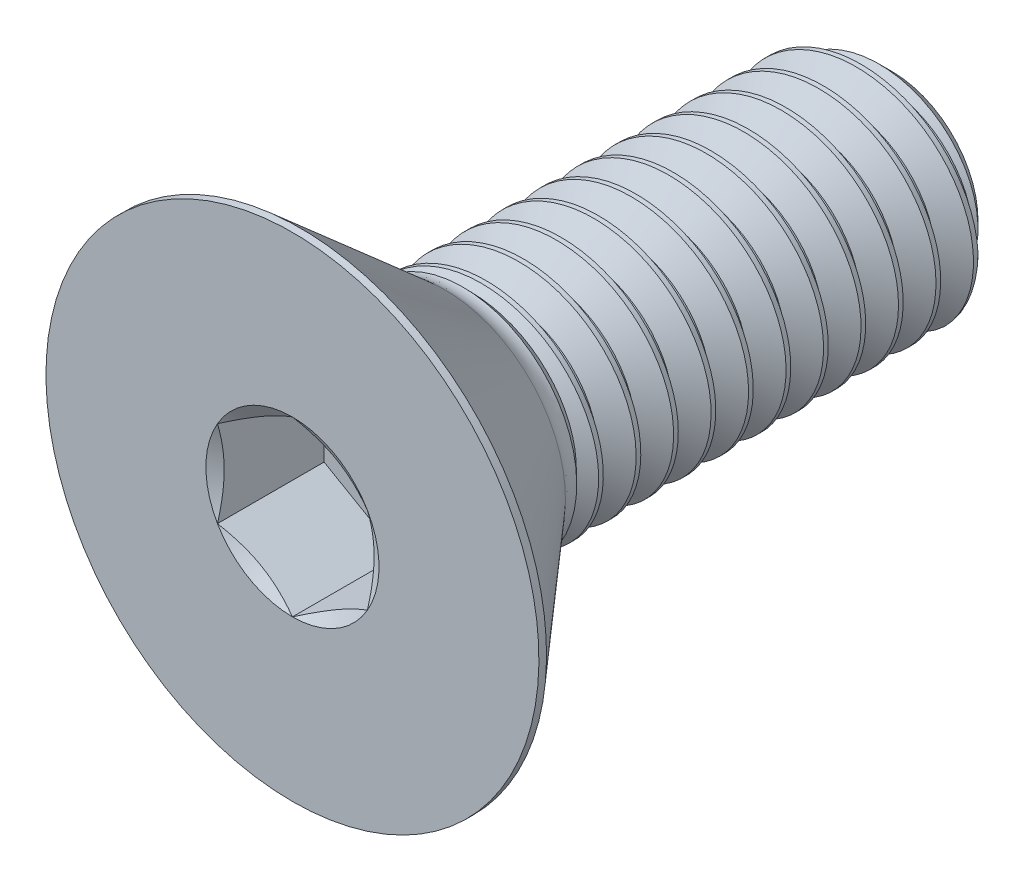
from build123d import *

# Parameters (mm, degrees)
SKETCH1_W          = 12.7
SKETCH1_H          = 2.413
CHAMFER1_SIZE      = 0.5953125
CUT_SWEEP1_PITCH   = 0.79375
CUT_EXTRUDE2_DEPTH = 2.25806


with BuildPart() as part:
    # Sketch1 → Revolve1 (revolve)
    with BuildSketch(Plane(origin=(0, 0, 0), x_dir=(0, 0, -1), z_dir=(1, 0, 0))):
        with Locations((6.35, 1.2065)):
            Rectangle(SKETCH1_W, SKETCH1_H)
    revolve(axis=Axis((0, 0, -12.7), (0, 0, 1)))

    # Chamfer1
    chamfer1_edges = [part.edges().sort_by_distance(p)[0] for p in [
        (0, -2.413, -12.7),
    ]]
    chamfer(chamfer1_edges, length=CHAMFER1_SIZE)

    # Cut-Sweep1: the profile of Sketch2 profile screwed along a right-hand helix of 16 turns, 8 arcs to a turn; built about Z, then put on its axis
    cut_sweep1_z = Axis((0, 0, 0), (0, 0, 1))
    cut_sweep1_corners = [(2.4136, 0, 0.00034641), (2.4136, 0, -0.69487766), (1.897444252, 0, -0.396875), (1.897444252, 0, -0.29765625)]
    with BuildLine(mode=Mode.PRIVATE) as cut_sweep1_profile:
        Line(cut_sweep1_corners[0], cut_sweep1_corners[1])
        Line(cut_sweep1_corners[1], cut_sweep1_corners[2])
        Line(cut_sweep1_corners[2], cut_sweep1_corners[3])
        Line(cut_sweep1_corners[3], cut_sweep1_corners[0])
    cut_sweep1_cap = Face(cut_sweep1_profile.wire())
    cut_sweep1_turn_angles = [0, 22.5, 45, 67.5, 90, 112.5, 135, 157.5, 180, 202.5, 225, 247.5, 270, 292.5, 315, 337.5, 360]
    cut_sweep1_turn_weights = [1, 0.9238795325112867, 1, 0.9238795325112867, 1, 0.9238795325112867, 1, 0.9238795325112867, 1, 0.9238795325112867, 1, 0.9238795325112867, 1, 0.9238795325112867, 1, 0.9238795325112867, 1]
    cut_sweep1_turn_rails = [Edge.make_bspline([Vector(p[0], p[1], 0).rotate(cut_sweep1_z, cut_sweep1_turn_angles[k]) / cut_sweep1_turn_weights[k] + Vector(0, 0, p[2] + CUT_SWEEP1_PITCH * cut_sweep1_turn_angles[k] / 360) for k in range(17)], [0, 0, 0, 1, 1, 2, 2, 3, 3, 4, 4, 5, 5, 6, 6, 7, 7, 8, 8, 8], 2, cut_sweep1_turn_weights) for p in cut_sweep1_corners]
    cut_sweep1_turn_sides = [Face.make_surface_from_curves(cut_sweep1_turn_rails[p[0]], cut_sweep1_turn_rails[p[1]]) for p in [(0, 1), (1, 2), (2, 3), (3, 0)]]
    cut_sweep1 = Plane(origin=(0, 0, -12.7), x_dir=(0, 1, 0), z_dir=(0, 0, 1)) * Solid(Shell([*[p.moved(Location((0, 0, CUT_SWEEP1_PITCH * i))) for i in range(16) for p in cut_sweep1_turn_sides], cut_sweep1_cap, cut_sweep1_cap.rotate(cut_sweep1_z, 5760).moved(Location((0, 0, CUT_SWEEP1_PITCH * 5760 / 360)))]))
    add(cut_sweep1, mode=Mode.SUBTRACT)

    # Sketch7 → Revolve2 (revolve)
    with BuildSketch(Plane(origin=(0, 0, 0), x_dir=(0, 0, -1), z_dir=(1, 0, 0)), mode=Mode.PRIVATE) as revolve2_sk:
        with BuildLine():
            Line((0, 5.2197), (0.16129, 5.2197))
            Line((0.16129, 5.2197), (3.2258, 2.555762099))
            ThreePointArc((3.2258, 2.555762099), (3.403809493, 2.44985758), (3.607634579, 2.413))
            Line((3.607634579, 2.413), (3.607634579, 0))
            Line((3.607634579, 0), (0, 0))
            Line((0, 0), (0, 5.2197))
        make_face()
    revolve(revolve2_sk.sketch.rotate(Axis((0, 0, 0), (0, 0, -1)), 189.052465709), axis=Axis((0, 0, 0), (0, 0, -1)))

    # Boss-Extrude1 cone 1 section (through the dimple's axis) → Boss-Extrude1 (revolve)
    with BuildSketch(Plane(origin=(0, 0, -3.607634579), x_dir=(0, -1, 0), z_dir=(1, 0, 0))):
        Polygon((0, 0), (2.413, 0), (0, 2.330207014), align=None)
    revolve(axis=Axis((0, 0, -3.607634579), (0, 0, -1)))

    # Sketch5 → Cut-Extrude2 (cut)
    with BuildSketch(Plane.XY):
        Polygon((0, 1.833087105), (-1.5875, 0.916543552), (-1.5875, -0.916543552), (0, -1.833087105), (1.5875, -0.916543552), (1.5875, 0.916543552), align=None)
    extrude(amount=-CUT_EXTRUDE2_DEPTH, mode=Mode.SUBTRACT)

    # Cut-Extrude3 cone 1 section (through the dimple's axis) → Cut-Extrude3 (revolve, cut)
    with BuildSketch(Plane(origin=(0, 0, 0), x_dir=(0, -1, 0), z_dir=(1, 0, 0))):
        Polygon((0, 0), (1.833087105, 0), (0, 1.058333333), align=None)
    revolve(axis=Axis((0, 0, 0), (0, 0, -1)), mode=Mode.SUBTRACT)


solid = part.part
